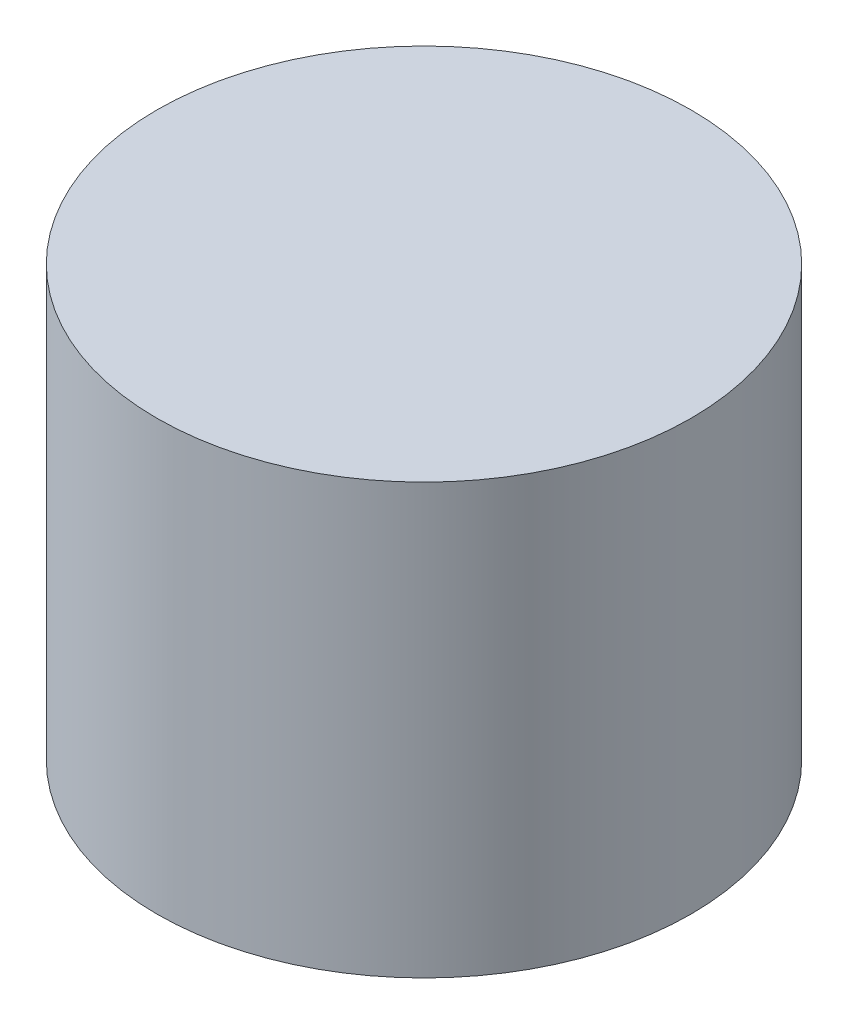
from build123d import *

# Parameters (mm, degrees)
SKETCH1_R           = 12.75
BOSS_EXTRUDE1_DEPTH = 20.5


with BuildPart() as part:
    # Sketch1 → Boss-Extrude1 (new body)
    with BuildSketch(Plane(origin=(0, 0, 0), x_dir=(1, 0, 0), z_dir=(0, 1, 0))):
        Circle(SKETCH1_R)
    extrude(amount=BOSS_EXTRUDE1_DEPTH)


solid = part.part
